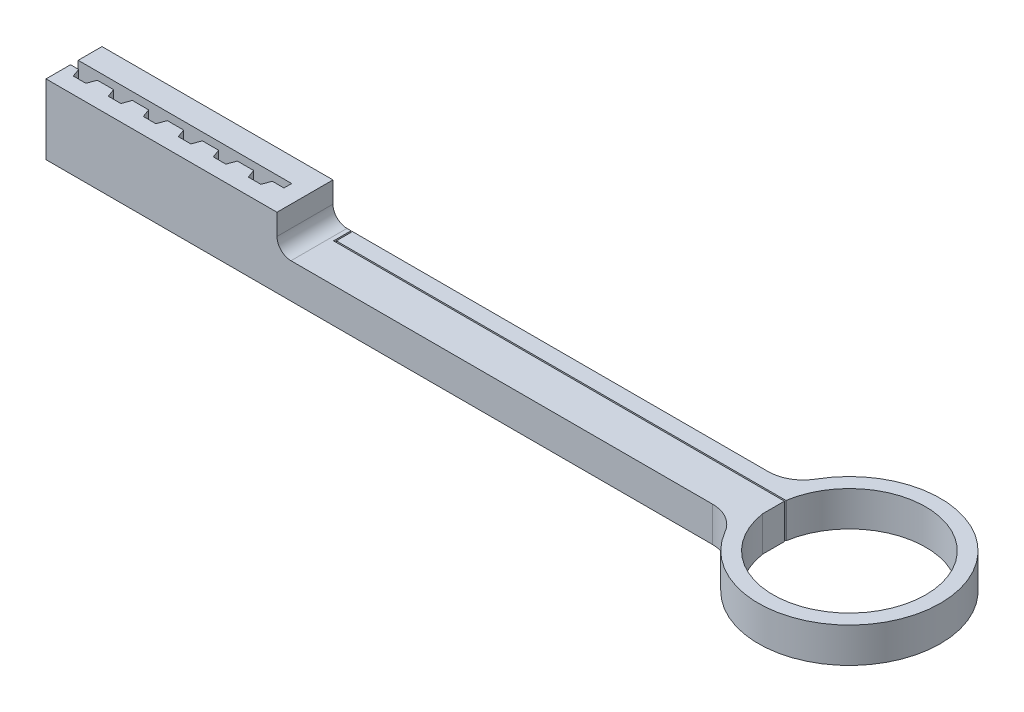
from build123d import *

# Parameters (mm, degrees)
SKETCH_1_R          = 13
SKETCH_1_R_2        = 10.9
RING_DEPTH          = 5
SKETCH_2_W          = 100
SKETCH_2_H          = 8
STICK_DEPTH         = 5
SKETCH_3_W          = 33
SKETCH_3_H          = 8
KEY_DEPTH           = 10
FILLET_1_R          = 5
FILLET_5_R          = 2
KEY_HOLE_DEPTH      = 112.793943777
KEY_HOLE_DEPTH_BACK = 112.793943777
CUT_EXTRUDE_2_DEPTH = 112.98944533


with BuildPart() as part:
    # Эскиз1 → ring (new body)
    with BuildSketch(Plane(origin=(0, 0, 0), x_dir=(1, 0, 0), z_dir=(0, 1, 0))):
        Circle(SKETCH_1_R)
        Circle(SKETCH_1_R_2, mode=Mode.SUBTRACT)
    extrude(amount=RING_DEPTH)

    # Эскиз2 → stick (add)
    with BuildSketch(Plane(origin=(0, 0, 0), x_dir=(1, 0, 0), z_dir=(0, 1, 0))):
        with Locations((-60.781929326, 0)):
            Rectangle(SKETCH_2_W, SKETCH_2_H)
    extrude(amount=STICK_DEPTH)

    # Эскиз3 → key (add)
    with BuildSketch(Plane(origin=(0, 0, 0), x_dir=(1, 0, 0), z_dir=(0, 1, 0))):
        with Locations((-94.281929326, 0)):
            Rectangle(SKETCH_3_W, SKETCH_3_H)
    extrude(amount=KEY_DEPTH)

    # Скругление1
    fillet_1_edges = [part.edges().sort_by_distance(p)[0] for p in [
        (-12.369316877, 2.5, 4),
        (-12.369316877, 2.5, -4),
    ]]
    fillet(fillet_1_edges, radius=FILLET_1_R)

    # Скругление5
    fillet_5_edges = [part.edges().sort_by_distance(p)[0] for p in [
        (-77.781929326, 5, 0),
    ]]
    fillet(fillet_5_edges, radius=FILLET_5_R)

    # Эскиз4 → key hole (cut, two sides: drawn at the far end of the back side and taken through both)
    with BuildSketch(Plane(origin=(0, 2.5, 0), x_dir=(1, 0, 0), z_dir=(0, 1, 0)).offset(-KEY_HOLE_DEPTH_BACK)):
        Polygon((-110.781929326, 0.6), (-80.281929326, 0.6), (-80.281929326, -0.5), (-80.781929326, -0.5), (-81.945165045, -0.5), (-82.381929326, -1.7), (-84.181929326, -1.7), (-84.618693608, -0.5), (-85.781929326, -0.5), (-86.945165045, -0.5), (-87.381929326, -1.7), (-89.181929326, -1.7), (-89.618693608, -0.5), (-90.781929326, -0.5), (-91.945165045, -0.5), (-92.381929326, -1.7), (-94.181929326, -1.7), (-94.618693608, -0.5), (-95.781929326, -0.5), (-96.945165045, -0.5), (-97.381929326, -1.7), (-99.181929326, -1.7), (-99.618693608, -0.5), (-100.781929326, -0.5), (-101.945165045, -0.5), (-102.381929326, -1.7), (-104.181929326, -1.7), (-104.618693608, -0.5), (-105.781929326, -0.5), (-106.945165045, -0.5), (-107.381929326, -1.7), (-109.181929326, -1.7), (-109.618693608, -0.5), (-110.781929326, -0.5), align=None)
    extrude(amount=KEY_HOLE_DEPTH + KEY_HOLE_DEPTH_BACK, mode=Mode.SUBTRACT)

    # Эскиз5 → Вытянуть2 (cut, through all)
    with BuildSketch(Plane.XZ):
        Polygon((-75.2, -4), (-75.2, -1.5), (0, -1.5), (0, -1.7), (-75, -1.7), (-75, -4), align=None)
    extrude(amount=-CUT_EXTRUDE_2_DEPTH, mode=Mode.SUBTRACT)


solid = part.part
